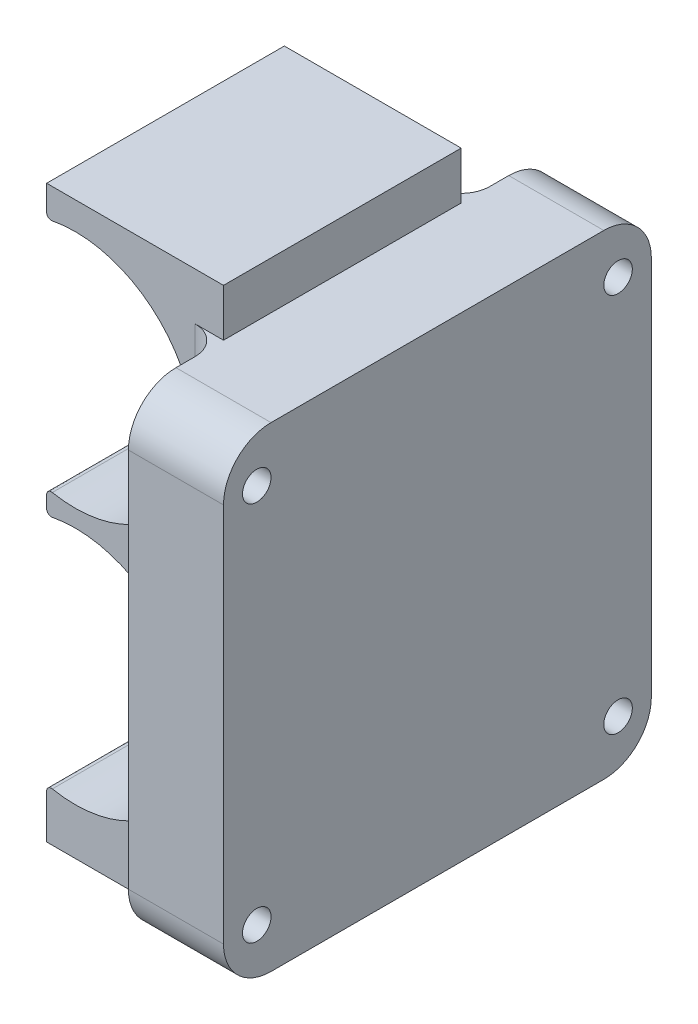
from build123d import *

# Parameters (mm, degrees)
BOSS_EXTRUDE1_DEPTH = 25
SKETCH2_W           = 18.6
SKETCH2_H           = 25
BOSS_EXTRUDE2_DEPTH = 2
FILLET1_R           = 0.5
SKETCH3_W           = 12.5
SKETCH3_H           = 50
SKETCH3_W_2         = 10
BOSS_EXTRUDE3_DEPTH = 10
FILLET2_R           = 3
SKETCH4_R           = 1.5
CUT_EXTRUDE1_DEPTH  = 71.249270459
FILLET3_R           = 5


with BuildPart() as part:
    # Sketch1 → Boss-Extrude1 (new body)
    with BuildSketch(Plane.XY):
        with BuildLine():
            Line((-18.6, 0), (0, 0))
            Line((0, 0), (0, 58))
            Line((0, 58), (-18.6, 58))
            Line((-18.6, 58), (-18.6, 54.737646833))
            ThreePointArc((-18.6, 54.737646833), (-7.823111162, 52.413626985), (-3, 42.5))
            ThreePointArc((-3, 42.5), (-7.823111162, 32.586373015), (-18.6, 30.262353167))
            Line((-18.6, 30.262353167), (-18.6, 27.737646833))
            ThreePointArc((-18.6, 27.737646833), (-7.823111162, 25.413626985), (-3, 15.5))
            ThreePointArc((-3, 15.5), (-7.823111162, 5.586373015), (-18.6, 3.262353167))
            Line((-18.6, 3.262353167), (-18.6, 0))
        make_face()
    extrude(amount=BOSS_EXTRUDE1_DEPTH)

    # Sketch2 → Boss-Extrude2 (add)
    with BuildSketch(Plane.XZ):
        with Locations((-9.3, 12.5)):
            Rectangle(SKETCH2_W, SKETCH2_H)
    extrude(amount=BOSS_EXTRUDE2_DEPTH)

    # Fillet1
    fillet1_edges = [part.edges().sort_by_distance(p)[0] for p in [
        (-18.6, 3.262353167, 12.5),
        (-18.6, 27.737646833, 12.5),
        (-18.6, 30.262353167, 12.5),
        (-18.6, 54.737646833, 12.5),
    ]]
    fillet(fillet1_edges, radius=FILLET1_R)

    # Sketch3 → Boss-Extrude3 (add)
    with BuildSketch(Plane(origin=(0, 0, 0), x_dir=(0, 0, -1), z_dir=(1, 0, 0))):
        with Locations((-18.75, 28)):
            Rectangle(SKETCH3_W, SKETCH3_H)
        with Locations((-6.25, 28)):
            Rectangle(SKETCH3_W, SKETCH3_H)
        with Locations((5, 28)):
            Rectangle(SKETCH3_W_2, SKETCH3_H)
        with Locations((-30, 28)):
            Rectangle(SKETCH3_W_2, SKETCH3_H)
    extrude(amount=BOSS_EXTRUDE3_DEPTH)

    # Fillet2
    fillet2_edges = [part.edges().sort_by_distance(p)[0] for p in [
        (0, 28, 0),
        (0, 28, 25),
    ]]
    fillet(fillet2_edges, radius=FILLET2_R - 0.0001)  # a hair under: the kernel refuses the full size

    # Sketch4 → Cut-Extrude1 (cut, through all)
    with BuildSketch(Plane.ZY):
        with Locations((-6.5, 48)):
            Circle(SKETCH4_R)
        with Locations((-6.5, 8)):
            Circle(SKETCH4_R)
        with Locations(Location((31.5, 8, 0), (0, 0, 180))):
            Circle(SKETCH4_R)
        with Locations(Location((31.5, 48, 0), (0, 0, 180))):
            Circle(SKETCH4_R)
    extrude(amount=-CUT_EXTRUDE1_DEPTH, mode=Mode.SUBTRACT)

    # Fillet3
    fillet3_edges = [part.edges().sort_by_distance(p)[0] for p in [
        (5, 3, 35),
        (5, 3, -10),
        (5, 53, -10),
        (5, 53, 35),
    ]]
    fillet(fillet3_edges, radius=FILLET3_R)


solid = part.part
